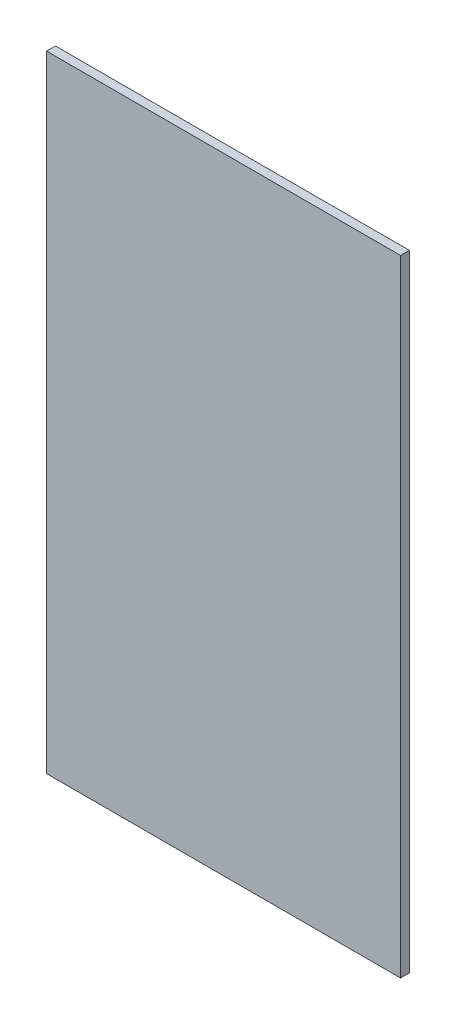
from build123d import *

# Parameters (mm, degrees)
SKETCH1_W           = 224.536
SKETCH1_H           = 127
BOSS_EXTRUDE1_DEPTH = 3.175


with BuildPart() as part:
    # Sketch1 → Boss-Extrude1 (new body)
    with BuildSketch(Plane(origin=(0, 0, 0), x_dir=(0, 1, 0), z_dir=(0, 0, 1))):
        Rectangle(SKETCH1_W, SKETCH1_H)
    extrude(amount=BOSS_EXTRUDE1_DEPTH)


solid = part.part
